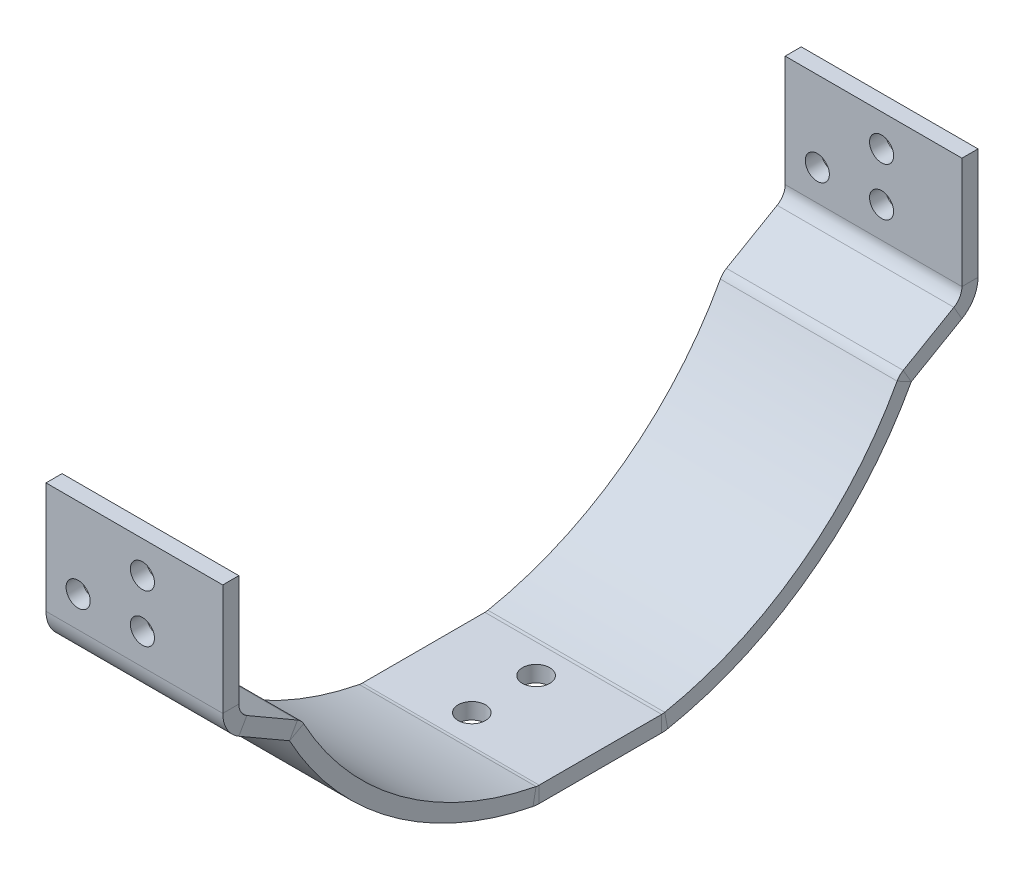
from build123d import *

# Parameters (mm, degrees)
BOSS_EXTRUDE1_DEPTH   = 22
FILLET1_R             = 2
F_3_0MM_DOWEL_HOLE2_D = 3
CONVERT_SOLID1_DEPTH  = 22
M3_CLEARANCE_HOLE1_D  = 3.4


# Read off the part's stored shape, not the designer's step: Convert-Solid1
with BuildPart() as part:
    # Sketch1 → Boss-Extrude1 (new body)
    with BuildSketch(Plane(origin=(0, 0, 0), x_dir=(0, 0, -1), z_dir=(1, 0, 0))):
        with BuildLine():
            Line((-45, -15), (-37.195759655, -19.505780264))
            ThreePointArc((-37.195759655, -19.505780264), (-24.9972884, -33.75108254), (-7.814503261, -41.266615306))
            Line((-7.814503261, -41.266615306), (7.814503261, -41.266615306))
            ThreePointArc((7.814503261, -41.266615306), (24.9972884, -33.75108254), (37.195759655, -19.505780264))
            Line((37.195759655, -19.505780264), (45, -15))
            Line((45, -15), (45, 0))
            Line((45, 0), (47, 0))
            Line((47, 0), (47, -16.154700538))
            Line((47, -16.154700538), (38.691455747, -20.9516408))
            ThreePointArc((38.691455747, -20.9516408), (25.874940227, -35.587743231), (8, -43.266615306))
            Line((8, -43.266615306), (-8, -43.266615306))
            ThreePointArc((-8, -43.266615306), (-25.874940227, -35.587743231), (-38.691455747, -20.9516408))
            Line((-38.691455747, -20.9516408), (-47, -16.154700538))
            Line((-47, -16.154700538), (-47, 0))
            Line((-47, 0), (-45, 0))
            Line((-45, 0), (-45, -15))
        make_face()
    extrude(amount=BOSS_EXTRUDE1_DEPTH)

    # Fillet1
    fillet1_edges = [part.edges().sort_by_distance(p)[0] for p in [
        (11, -16.154700538, 47),
        (11, -15, 45),
        (11, -19.505780264, 37.195759655),
        (11, -41.266615306, 7.814503261),
        (11, -41.266615306, -7.814503261),
        (11, -19.505780264, -37.195759655),
        (11, -15, -45),
        (11, -16.154700538, -47),
        (11, -20.9516408, -38.691455747),
        (11, -43.266615306, -8),
        (11, -43.266615306, 8),
        (11, -20.9516408, 38.691455747),
    ]]
    fillet(fillet1_edges, radius=FILLET1_R)

    # Ø3.0mm Dowel Hole2 (through all)
    with Locations(Plane.XY.offset(47)):
        with Locations((4, -10), (12, -10), (12, -4)):
            Hole(F_3_0MM_DOWEL_HOLE2_D / 2)

    # Convert-Solid1 outline → Convert-Solid1 (cut)
    with BuildSketch(Plane.YZ):
        with BuildLine():
            ThreePointArc((-13.845299462, -47), (-15.845299462, -46.464101615), (-17.309401077, -45))
            Line((-17.309401077, -45), (-16.732050808, -46))
            ThreePointArc((-16.732050808, -46), (-16, -46.732050808), (-15, -47))
            Line((-15, -47), (-13.845299462, -47))
        make_face()
        with BuildLine():
            Line((-16.732050808, 46), (-17.309401077, 45))
            ThreePointArc((-17.309401077, 45), (-15.845299462, 46.464101615), (-13.845299462, 47))
            Line((-13.845299462, 47), (-15, 47))
            ThreePointArc((-15, 47), (-16, 46.732050808), (-16.732050808, 46))
        make_face()
        with BuildLine():
            ThreePointArc((-20.672392382, 39.175128193), (-21.000794949, 38.750427658), (-21.430336964, 38.428383489))
            ThreePointArc((-21.430336964, 38.428383489), (-21.191397112, 38.560662449), (-20.9516408, 38.691455747))
            Line((-20.9516408, 38.691455747), (-20.672392382, 39.175128193))
        make_face()
        with BuildLine():
            Line((-43.266615306, 7.814503261), (-43.266615306, 7.624494898))
            ThreePointArc((-43.266615306, 7.624494898), (-43.248238475, 8.007479152), (-43.193276836, 8.386944387))
            ThreePointArc((-43.193276836, 8.386944387), (-43.212600611, 8.286805686), (-43.231692225, 8.186622464))
            ThreePointArc((-43.231692225, 8.186622464), (-43.257865395, 8.001380442), (-43.266615306, 7.814503261))
        make_face()
        with BuildLine():
            ThreePointArc((-43.231692225, -8.186622464), (-43.212600611, -8.286805686), (-43.193276836, -8.386944387))
            ThreePointArc((-43.193276836, -8.386944387), (-43.248238475, -8.007479152), (-43.266615306, -7.624494898))
            Line((-43.266615306, -7.624494898), (-43.266615306, -7.814503261))
            ThreePointArc((-43.266615306, -7.814503261), (-43.257865395, -8.001380442), (-43.231692225, -8.186622464))
        make_face()
        with BuildLine():
            ThreePointArc((-21.430336964, -38.428383489), (-21.000794949, -38.750427658), (-20.672392382, -39.175128193))
            Line((-20.672392382, -39.175128193), (-20.9516408, -38.691455747))
            ThreePointArc((-20.9516408, -38.691455747), (-21.191397112, -38.560662449), (-21.430336964, -38.428383489))
        make_face()
    extrude(amount=CONVERT_SOLID1_DEPTH, mode=Mode.SUBTRACT)

    # M3 Clearance Hole1 (through all)
    with Locations(Plane(origin=(0, -41.266615306, 0), x_dir=(1, 0, 0), z_dir=(0, 1, 0))):
        with Locations((10, 3.99745139), (10, -4.00254861)):
            Hole(M3_CLEARANCE_HOLE1_D / 2)


solid = part.part
